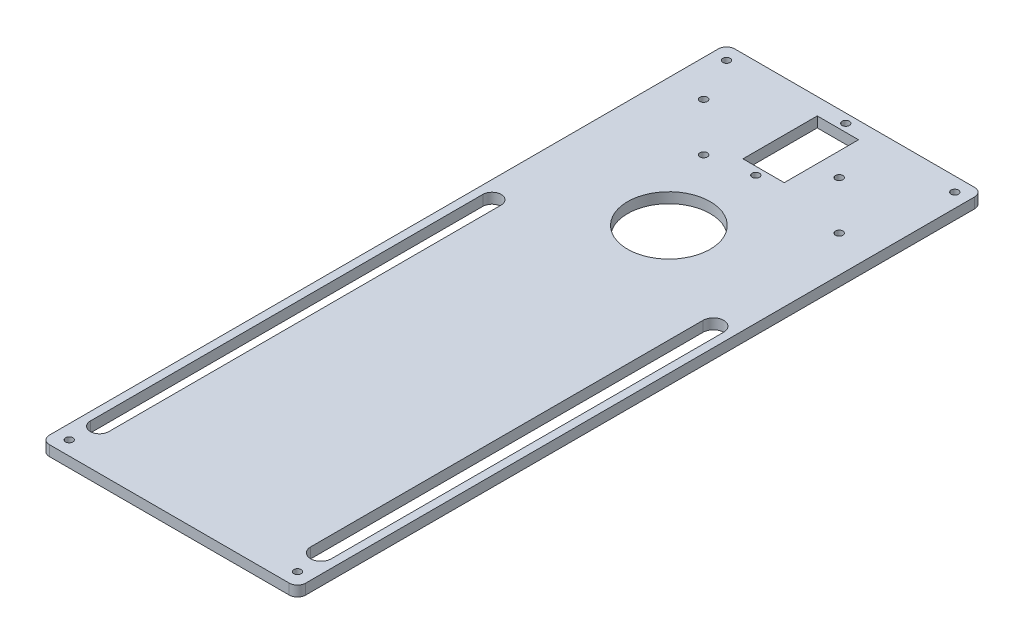
from build123d import *

# Parameters (mm, degrees)
SKETCH2_W           = 78.8444702
SKETCH2_H           = 3.2004
BOSS_EXTRUDE1_DEPTH = 210.82
SKETCH3_R           = 12.7
SKETCH3_R_2         = 1.1303
SKETCH3_R_3         = 1.143
SKETCH3_W           = 12.7
SKETCH3_H           = 22.86
CUT_EXTRUDE1_DEPTH  = 216.478809771
FILLET1_R           = 2.54


with BuildPart() as part:
    # Sketch2 → Boss-Extrude1 (new body)
    with BuildSketch(Plane.XY):
        with Locations((-5.0277649, -1.6002)):
            Rectangle(SKETCH2_W, SKETCH2_H)
    extrude(amount=BOSS_EXTRUDE1_DEPTH)

    # Sketch3 → Cut-Extrude1 (cut, through all)
    with BuildSketch(Plane.XZ.offset(3.2004)):
        with Locations((-5.0277649, 57.15)):
            Circle(SKETCH3_R)
        with Locations((-40.132, 206.502)):
            Circle(SKETCH3_R_2)
        with Locations((30.0764702, 206.502)):
            Circle(SKETCH3_R_2)
        with Locations((-40.132, 4.318)):
            Circle(SKETCH3_R_2)
        with Locations((30.0764702, 4.318)):
            Circle(SKETCH3_R_2)
        with Locations((-5.0277649, 30.425887591)):
            Circle(SKETCH3_R_2)
        with Locations((-5.0277649, 2.765287591)):
            Circle(SKETCH3_R_2)
        with Locations((23.2108502, 33.02)):
            Circle(SKETCH3_R_3)
        with Locations((8.424210122, 18.233359922)):
            Circle(SKETCH3_R_3)
        with Locations((-18.479739922, 33.02)):
            Circle(SKETCH3_R_3)
        with Locations((-33.26638, 18.233359922)):
            Circle(SKETCH3_R_3)
        with BuildLine():
            Line((-41.91, 77.517412284), (-41.91, 198.224041398))
            ThreePointArc((-41.91, 198.224041398), (-39.076175505, 201.057865893), (-36.24235101, 198.224041398))
            Line((-36.24235101, 198.224041398), (-36.24235101, 77.517412284))
            ThreePointArc((-36.24235101, 77.517412284), (-39.076175505, 74.683587789), (-41.91, 77.517412284))
        make_face()
        with BuildLine():
            Line((25.5044702, 77.176236779), (25.5044702, 197.882865893))
            ThreePointArc((25.5044702, 197.882865893), (28.6794702, 201.057865893), (31.8544702, 197.882865893))
            Line((31.8544702, 197.882865893), (31.8544702, 77.176236779))
            ThreePointArc((31.8544702, 77.176236779), (28.6794702, 74.001236779), (25.5044702, 77.176236779))
        make_face()
        with Locations((-5.0277649, 16.595587591)):
            Rectangle(SKETCH3_W, SKETCH3_H)
    extrude(amount=-CUT_EXTRUDE1_DEPTH, mode=Mode.SUBTRACT)

    # Fillet1
    fillet1_edges = [part.edges().sort_by_distance(p)[0] for p in [
        (34.3944702, -1.6002, 210.82),
        (-44.45, -1.6002, 210.82),
        (-44.45, -1.6002, 0),
        (34.3944702, -1.6002, 0),
    ]]
    fillet(fillet1_edges, radius=FILLET1_R)


solid = part.part
